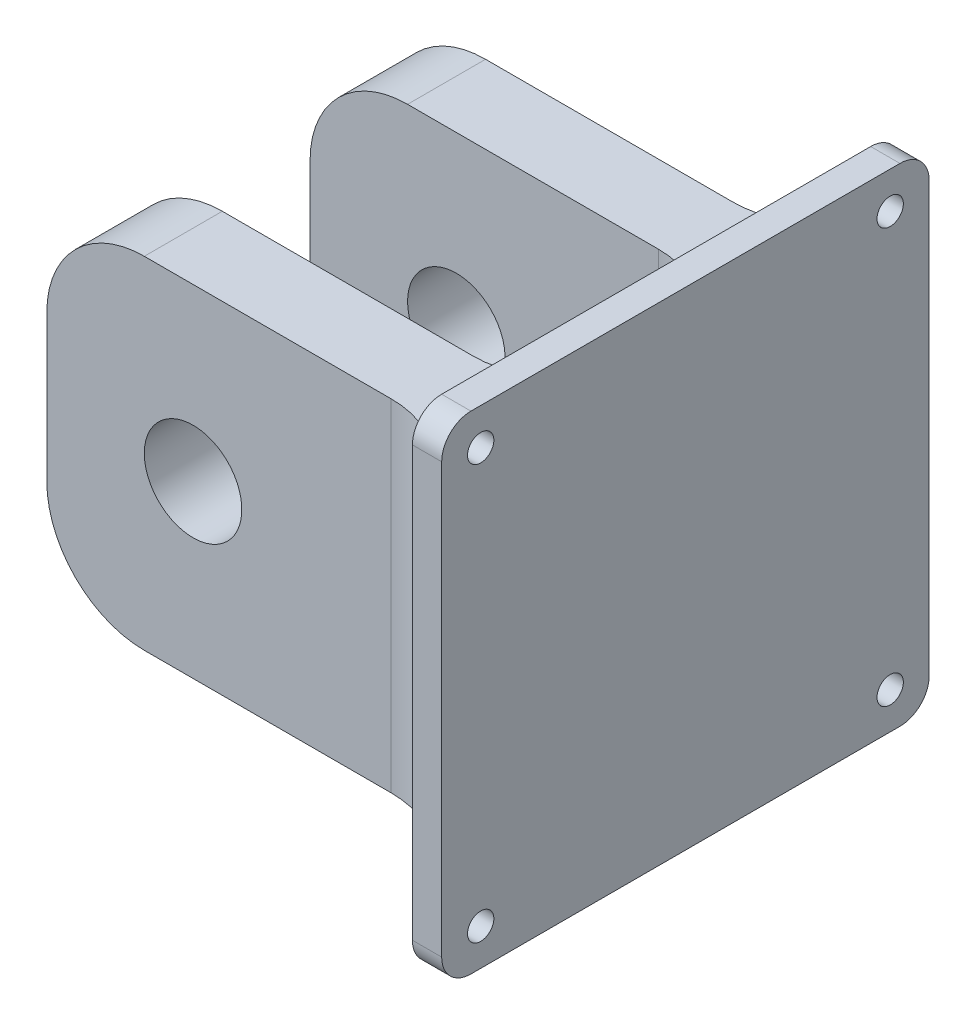
from build123d import *

# Parameters (mm, degrees)
ESQUISSE3_W             = 50
ESQUISSE3_H             = 50
BOSS_EXTRU_3_DEPTH      = 3
ESQUISSE4_W             = 8
ESQUISSE4_H             = 35
BOSS_EXTRU_5_DEPTH      = 45
ESQUISSE7_R             = 5
ENL_V_MAT_EXTRU_1_DEPTH = 40
CONG_1_R                = 10
CONG_2_R                = 9.25
CONG_3_R                = 3
D_GAGEMENT_M2_51_D      = 2.7


with BuildPart() as part:
    # Esquisse3 → Boss.-Extru.3 (new body)
    with BuildSketch(Plane(origin=(0, 0, 0), x_dir=(0, 0, -1), z_dir=(1, 0, 0))):
        Rectangle(ESQUISSE3_W, ESQUISSE3_H)
    extrude(amount=BOSS_EXTRU_3_DEPTH)

    # Esquisse4 → Boss.-Extru.5 (add)
    with BuildSketch(Plane(origin=(0, 0, 0), x_dir=(0, 0, -1), z_dir=(1, 0, 0))):
        with Locations((-13.5, 0)):
            Rectangle(ESQUISSE4_W, ESQUISSE4_H)
        with Locations((13.5, 0)):
            Rectangle(ESQUISSE4_W, ESQUISSE4_H)
    extrude(amount=-BOSS_EXTRU_5_DEPTH)

    # Esquisse7 → Enlèv. mat.-Extru.1 (cut)
    with BuildSketch(Plane(origin=(0, 0, -17.5), x_dir=(-1, 0, 0), z_dir=(0, 0, -1))):
        with Locations((30, 0)):
            Circle(ESQUISSE7_R)
    extrude(amount=-ENL_V_MAT_EXTRU_1_DEPTH, mode=Mode.SUBTRACT)

    # Congé1
    # the kernel refuses this fillet: 10 mm, written as the material it adds along each edge
    with BuildSketch(Plane(origin=(0, -17.5, 17.5), x_dir=(0, 0, 1), z_dir=(0, 1, 0))) as cong_1_piece_1:
        with BuildLine():
            CenterArc((10, -9.682458366), CONG_1_R, 104.477512186, 75.522487814)
            Line((0, -9.682458366), (0, 0))
            Line((0, 0), (7.5, 0))
        make_face()
    extrude(amount=35)
    with BuildSketch(Plane(origin=(0, -17.5, -17.5), x_dir=(0, 0, -1), z_dir=(0, 1, 0))) as cong_1_piece_2:
        with BuildLine():
            CenterArc((10, 9.682458366), CONG_1_R, 180, 75.522487814)
            Line((0, 9.682458366), (0, 0))
            Line((0, 0), (7.5, 0))
        make_face()
    extrude(amount=35)
    # the kernel refuses this fillet: 10 mm, written as the material it takes off along each edge
    with BuildSketch(Plane(origin=(-45, 17.5, 42.5), x_dir=(0, -1, 0), z_dir=(0, 0, -1)), Plane(origin=(-45, 17.5, -42.5), x_dir=(1, 0, 0), z_dir=(0, 0, 1))) as cong_1_2_piece_1:
        with BuildLine():
            CenterArc((CONG_1_R, -CONG_1_R), CONG_1_R, 90, 90)
            Line((0, -CONG_1_R), (0, 0))
            Line((0, 0), (CONG_1_R, 0))
        make_face()
    extrude(amount=58, mode=Mode.SUBTRACT)
    with BuildSketch(Plane(origin=(-45, -17.5, -15.5), x_dir=(1, 0, 0), z_dir=(0, 0, 1)), Plane(origin=(-45, -17.5, 15.5), x_dir=(0, 1, 0), z_dir=(0, 0, -1))) as cong_1_2_piece_2:
        with BuildLine():
            CenterArc((CONG_1_R, CONG_1_R), CONG_1_R, 180, 90)
            Line((0, CONG_1_R), (0, 0))
            Line((0, 0), (CONG_1_R, 0))
        make_face()
    extrude(amount=58, mode=Mode.SUBTRACT)

    # Congé2
    cong_2_edges = [part.edges().sort_by_distance(p)[0] for p in [
        (0, 0, 9.5),
        (0, 0, -9.5),
    ]]
    fillet(cong_2_edges, radius=CONG_2_R)

    # Congé3
    cong_3_edges = [part.edges().sort_by_distance(p)[0] for p in [
        (1.5, -25, -25),
        (1.5, -25, 25),
        (1.5, 25, 25),
        (1.5, 25, -25),
    ]]
    fillet(cong_3_edges, radius=CONG_3_R)

    # Dégagement M2.51 (through all)
    with Locations(Plane.ZY):
        with Locations((21, 21.25), (-21, 21.25), (-21, -21.25), (21, -21.25)):
            Hole(D_GAGEMENT_M2_51_D / 2)


solid = part.part
